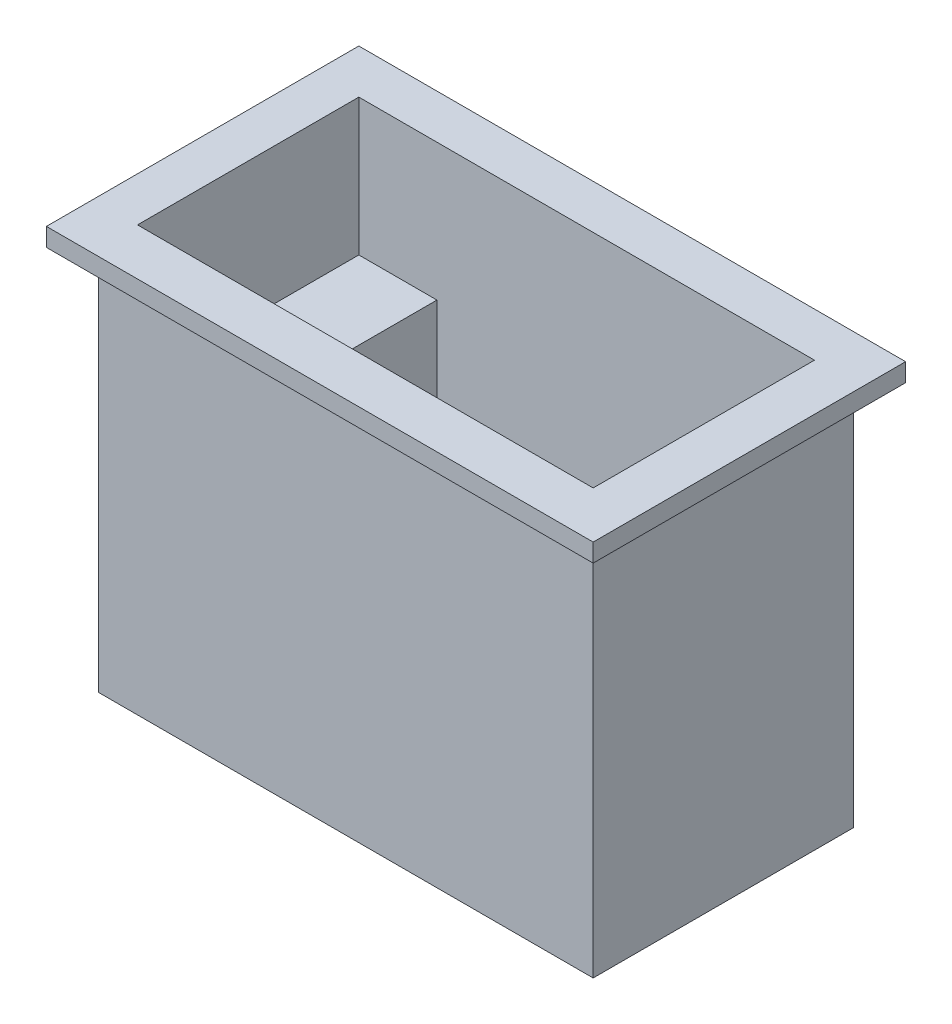
from build123d import *

# Parameters (mm, degrees)
SKETCH1_W           = 38
SKETCH1_H           = 20
BOSS_EXTRUDE1_DEPTH = 31
SKETCH2_W           = 35
SKETCH2_H           = 17
CUT_EXTRUDE1_DEPTH  = 28
SKETCH3_W           = 6
SKETCH3_H           = 17
BOSS_EXTRUDE2_DEPTH = 17.5
SKETCH4_W           = 42
SKETCH4_H           = 24
SKETCH4_W_2         = 38
SKETCH4_H_2         = 20
EXTRUDE_THIN2_DEPTH = 1.4
SKETCH5_R           = 1
CUT_EXTRUDE2_DEPTH  = 3
SKETCH6_R           = 1
CUT_EXTRUDE3_DEPTH  = 3
SKETCH7_W           = 9.4
SKETCH7_H           = 4.5
CUT_EXTRUDE4_DEPTH  = 10
SKETCH8_W           = 20
SKETCH8_H           = 10
CUT_EXTRUDE5_DEPTH  = 1.5
SKETCH9_R           = 3.7
SKETCH9_R_2         = 1
CUT_EXTRUDE6_DEPTH  = 1.7
FILLET1_R           = 4


with BuildPart() as part:
    # Sketch1 → Boss-Extrude1 (new body)
    with BuildSketch(Plane(origin=(0, 0, 0), x_dir=(1, 0, 0), z_dir=(0, 1, 0))):
        with Locations((8.6, -4.057142857)):
            Rectangle(SKETCH1_W, SKETCH1_H)
    extrude(amount=BOSS_EXTRUDE1_DEPTH)

    # Sketch2 → Cut-Extrude1 (cut)
    with BuildSketch(Plane(origin=(0, 31, 0), x_dir=(1, 0, 0), z_dir=(0, 1, 0))):
        with Locations((8.5, -3.957142857)):
            Rectangle(SKETCH2_W, SKETCH2_H)
    extrude(amount=-CUT_EXTRUDE1_DEPTH, mode=Mode.SUBTRACT)

    # Sketch3 → Boss-Extrude2 (add)
    with BuildSketch(Plane(origin=(0, 3, 0), x_dir=(1, 0, 0), z_dir=(0, 1, 0))):
        with Locations((-6, -3.957142857)):
            Rectangle(SKETCH3_W, SKETCH3_H)
        with Locations((23, -3.957142857)):
            Rectangle(SKETCH3_W, SKETCH3_H)
    extrude(amount=BOSS_EXTRUDE2_DEPTH)

    # Sketch4 → Extrude-Thin2 (add)
    with BuildSketch(Plane(origin=(0, 31, 0), x_dir=(1, 0, 0), z_dir=(0, 1, 0))):
        with Locations((8.6, -4.057142857)):
            Rectangle(SKETCH4_W, SKETCH4_H)
        with Locations((8.6, -4.057142857)):
            Rectangle(SKETCH4_W_2, SKETCH4_H_2, mode=Mode.SUBTRACT)
    extrude(amount=-EXTRUDE_THIN2_DEPTH)

    # Sketch5 → Cut-Extrude2 (cut)
    with BuildSketch(Plane(origin=(0, 20.5, 0), x_dir=(1, 0, 0), z_dir=(0, 1, 0))):
        with Locations((-5.5, -3.892148731)):
            Circle(SKETCH5_R)
    extrude(amount=-CUT_EXTRUDE2_DEPTH, mode=Mode.SUBTRACT)

    # Sketch6 → Cut-Extrude3 (cut)
    with BuildSketch(Plane(origin=(0, 20.5, 0), x_dir=(1, 0, 0), z_dir=(0, 1, 0))):
        with Locations((22.953148274, -4.115727136)):
            Circle(SKETCH6_R)
    extrude(amount=-CUT_EXTRUDE3_DEPTH, mode=Mode.SUBTRACT)

    # Sketch7 → Cut-Extrude4 (cut)
    with BuildSketch(Plane(origin=(-3, 0, 0), x_dir=(0, 0, -1), z_dir=(1, 0, 0))):
        with Locations((-3.757142857, 6.291369126)):
            Rectangle(SKETCH7_W, SKETCH7_H)
    extrude(amount=-CUT_EXTRUDE4_DEPTH, mode=Mode.SUBTRACT)

    # Sketch8 → Cut-Extrude5 (cut)
    with BuildSketch(Plane(origin=(0, 3, 0), x_dir=(1, 0, 0), z_dir=(0, 1, 0))):
        with Locations((8.592117784, -3.72787339)):
            Rectangle(SKETCH8_W, SKETCH8_H)
    extrude(amount=-CUT_EXTRUDE5_DEPTH, mode=Mode.SUBTRACT)

    # Sketch9 → Cut-Extrude6 (cut)
    with BuildSketch(Plane(origin=(0, 1.5, 0), x_dir=(1, 0, 0), z_dir=(0, 1, 0))):
        with Locations((8.808284604, -3.634888569)):
            Circle(SKETCH9_R)
        with Locations((1.608284604, -3.634888569)):
            Circle(SKETCH9_R_2)
        with Locations((16.008284604, -3.634888569)):
            Circle(SKETCH9_R_2)
    extrude(amount=-CUT_EXTRUDE6_DEPTH, mode=Mode.SUBTRACT)

    # Fillet1
    fillet1_edges = [part.edges().sort_by_distance(p)[0] for p in [
        (18.592117784, 2.25, -1.27212661),
        (18.592117784, 2.25, 8.72787339),
        (-1.407882216, 2.25, -1.27212661),
        (-1.407882216, 2.25, 8.72787339),
    ]]
    fillet(fillet1_edges, radius=FILLET1_R)


solid = part.part
